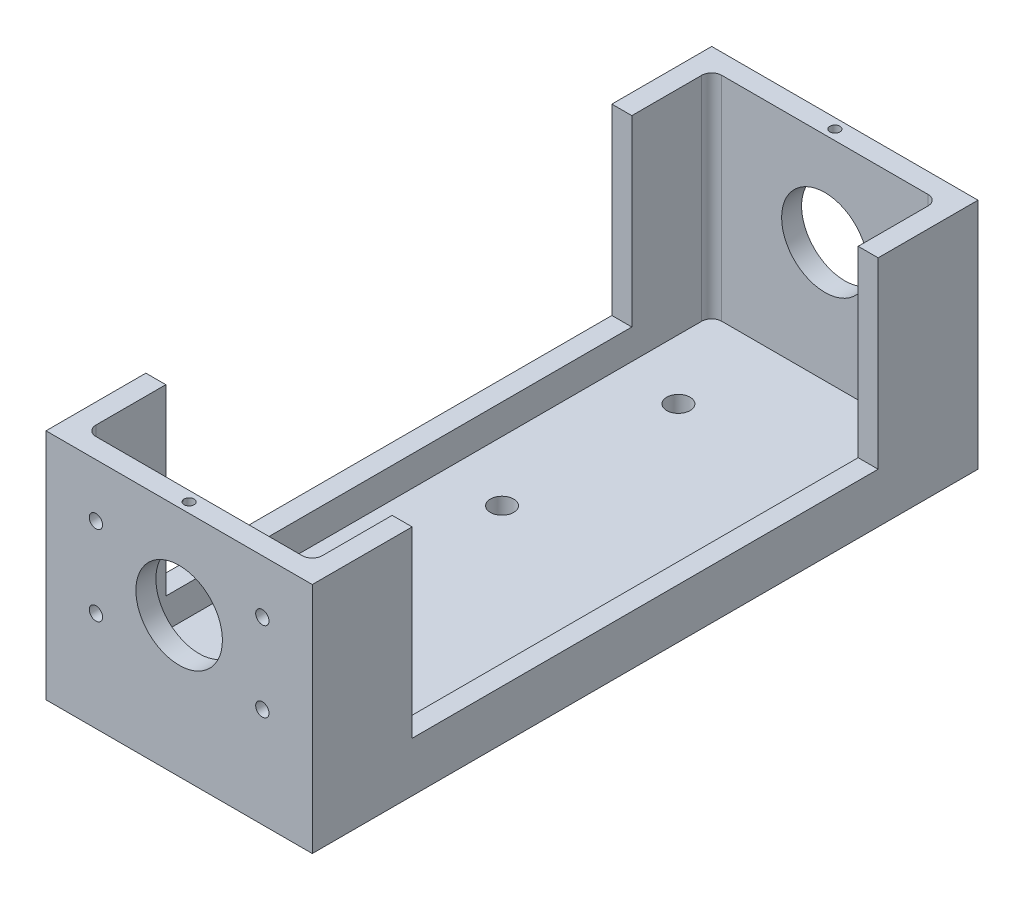
from build123d import *

# Parameters (mm, degrees)
SKETCH_1_W          = 80
SKETCH_1_H          = 70
EXTRUDE_1_DEPTH     = 200
CUT_EXTRUDE_1_DEPTH = 64
SKETCH_3_R          = 13
CUT_EXTRUDE_2_DEPTH = 207.942020866
SKETCH_4_R          = 2
SKETCH_4_W          = 27
SKETCH_4_H          = 36
CUT_EXTRUDE_3_DEPTH = 10
SKETCH_6_R          = 3.500000002
SKETCH_6_R_2        = 3.5
CUT_EXTRUDE_5_DEPTH = 10
SKETCH_7_R          = 1.5
CUT_EXTRUDE_6_DEPTH = 10
SKETCH_8_W          = 140
SKETCH_8_H          = 55
CUT_EXTRUDE_7_DEPTH = 219.231528428
SKETCH_9_R          = 2
CUT_EXTRUDE_8_DEPTH = 6


with BuildPart() as part:
    # 草图1 → 凸台-拉伸1 (new body)
    with BuildSketch(Plane.XY):
        Rectangle(SKETCH_1_W, SKETCH_1_H)
    extrude(amount=-EXTRUDE_1_DEPTH)

    # 草图2 → 切除-拉伸1 (cut)
    with BuildSketch(Plane(origin=(0, 35, 0), x_dir=(1, 0, 0), z_dir=(0, 1, 0))):
        with BuildLine():
            ThreePointArc((-31, 194), (-33.121320344, 193.121320344), (-34, 191))
            Line((-34, 191), (-34, 9))
            ThreePointArc((-34, 9), (-33.121320344, 6.878679656), (-31, 6))
            Line((-31, 6), (31, 6))
            ThreePointArc((31, 6), (33.121320344, 6.878679656), (34, 9))
            Line((34, 9), (34, 191))
            ThreePointArc((34, 191), (33.121320344, 193.121320344), (31, 194))
            Line((31, 194), (-31, 194))
        make_face()
    extrude(amount=-CUT_EXTRUDE_1_DEPTH, mode=Mode.SUBTRACT)

    # 草图3 → 切除-拉伸2 (cut, through all)
    with BuildSketch(Plane.XY):
        with Locations((0, 7)):
            Circle(SKETCH_3_R)
    extrude(amount=-CUT_EXTRUDE_2_DEPTH, mode=Mode.SUBTRACT)

    # 草图4 → 切除-拉伸3 (cut)
    with BuildSketch(Plane.ZY.offset(40)):
        with Locations((-121.5, 2)):
            Circle(SKETCH_4_R)
        with Locations((-121.5, 26)):
            Circle(SKETCH_4_R)
        with Locations((-158.5, 26)):
            Circle(SKETCH_4_R)
        with Locations((-158.5, 2)):
            Circle(SKETCH_4_R)
        with Locations((-140, 14)):
            Rectangle(SKETCH_4_W, SKETCH_4_H)
    extrude(amount=-CUT_EXTRUDE_3_DEPTH, mode=Mode.SUBTRACT)

    # 草图6 → 切除-拉伸5 (cut)
    with BuildSketch(Plane(origin=(0, -29, 0), x_dir=(1, 0, 0), z_dir=(0, 1, 0))):
        with Locations((-16, 166)):
            Circle(SKETCH_6_R)
        with Locations((-16, 113)):
            Circle(SKETCH_6_R_2)
    extrude(amount=-CUT_EXTRUDE_5_DEPTH, mode=Mode.SUBTRACT)

    # 草图7 → 切除-拉伸6 (cut)
    with BuildSketch(Plane(origin=(0, 35, 0), x_dir=(1, 0, 0), z_dir=(0, 1, 0))):
        with Locations((-37, 150)):
            Circle(SKETCH_7_R)
        with Locations((-37, 50)):
            Circle(SKETCH_7_R)
        with Locations((37, 50)):
            Circle(SKETCH_7_R)
        with Locations((37, 150)):
            Circle(SKETCH_7_R)
        with Locations((0, 197)):
            Circle(SKETCH_7_R)
        with Locations((0, 3)):
            Circle(SKETCH_7_R)
    extrude(amount=-CUT_EXTRUDE_6_DEPTH, mode=Mode.SUBTRACT)

    # 草图8 → 切除-拉伸7 (cut, through all)
    with BuildSketch(Plane(origin=(40, 0, 0), x_dir=(0, 0, -1), z_dir=(1, 0, 0))):
        with Locations((100, 7.5)):
            Rectangle(SKETCH_8_W, SKETCH_8_H)
    extrude(amount=-CUT_EXTRUDE_7_DEPTH, mode=Mode.SUBTRACT)

    # 草图9 → 切除-拉伸8 (cut)
    with BuildSketch(Plane(origin=(0, 0, -6), x_dir=(-1, 0, 0), z_dir=(0, 0, -1))):
        with Locations((-25, -5)):
            Circle(SKETCH_9_R)
        with Locations((-25, 19)):
            Circle(SKETCH_9_R)
        with Locations((25, 19)):
            Circle(SKETCH_9_R)
        with Locations((25, -5)):
            Circle(SKETCH_9_R)
    extrude(amount=-CUT_EXTRUDE_8_DEPTH, mode=Mode.SUBTRACT)


solid = part.part
